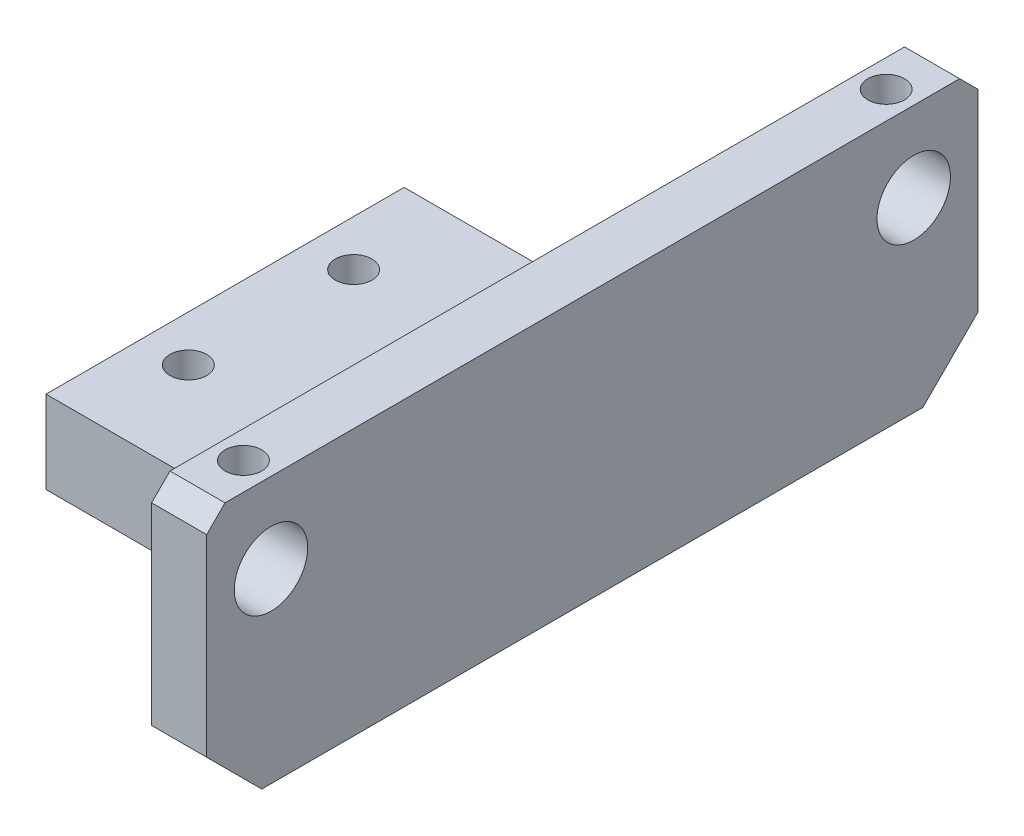
from build123d import *

# Parameters (mm, degrees)
SKETCH1_W           = 34
SKETCH1_H           = 39
SKETCH1_R           = 2
BOSS_EXTRUDE1_DEPTH = 5
SKETCH2_W           = 6
SKETCH2_H           = 84
BOSS_EXTRUDE2_DEPTH = 25
CUT_EXTRUDE2_REACH  = 65.159
SKETCH3_R           = 4
CHAMFER1_SIZE       = 2
SKETCH4_R           = 2
CUT_EXTRUDE3_DEPTH  = 10
BOSS_EXTRUDE3_DEPTH = 4
SKETCH6_R           = 3.7
CUT_EXTRUDE4_DEPTH  = 5
CHAMFER2_SIZE       = 4
CUT_EXTRUDE5_REACH  = 57.982
SKETCH7_R           = 1.35


with BuildPart() as part:
    # Sketch1 → Boss-Extrude1 (new body)
    with BuildSketch(Plane(origin=(0, 0, 0), x_dir=(1, 0, 0), z_dir=(0, 1, 0))):
        Rectangle(SKETCH1_W, SKETCH1_H)
        with Locations(Location((-12, -9, 0), (0, 0, 270))):
            Circle(SKETCH1_R, mode=Mode.SUBTRACT)
        with Locations(Location((12, -9, 0), (0, 0, 90))):
            Circle(SKETCH1_R, mode=Mode.SUBTRACT)
        with Locations(Location((12, 9, 0), (0, 0, 270))):
            Circle(SKETCH1_R, mode=Mode.SUBTRACT)
        with Locations(Location((-12, 9, 0), (0, 0, 90))):
            Circle(SKETCH1_R, mode=Mode.SUBTRACT)
    extrude(amount=BOSS_EXTRUDE1_DEPTH)

    # Sketch2 → Boss-Extrude2 (add)
    with BuildSketch(Plane.XZ):
        with Locations((20, 0)):
            Rectangle(SKETCH2_W, SKETCH2_H)
    extrude(amount=-BOSS_EXTRUDE2_DEPTH)

    # Sketch3 → Cut-Extrude2 (cut, up to next)
    with BuildSketch(Plane(origin=(23, 0, 0), x_dir=(0, 0, -1), z_dir=(1, 0, 0)), mode=Mode.PRIVATE) as cut_extrude2_sk1:
        with Locations((-35, 16.275206728)):
            Circle(SKETCH3_R)
    cut_extrude2_tool1 = extrude(cut_extrude2_sk1.sketch, amount=-CUT_EXTRUDE2_REACH, mode=Mode.PRIVATE) & part.part
    # Sketch3 → Cut-Extrude2 (cut, up to next)
    with BuildSketch(Plane(origin=(23, 0, 0), x_dir=(0, 0, -1), z_dir=(1, 0, 0)), mode=Mode.PRIVATE) as cut_extrude2_sk2:
        with Locations((35, 16.275206728)):
            Circle(SKETCH3_R)
    cut_extrude2_tool2 = extrude(cut_extrude2_sk2.sketch, amount=-CUT_EXTRUDE2_REACH, mode=Mode.PRIVATE) & part.part
    add(cut_extrude2_tool1.solids().sort_by_distance((23, 16.275207, 35))[0], mode=Mode.SUBTRACT)
    add(cut_extrude2_tool2.solids().sort_by_distance((23, 16.275207, -35))[0], mode=Mode.SUBTRACT)

    # Chamfer1
    chamfer1_edges = [part.edges().sort_by_distance(p)[0] for p in [
        (20, 25, -42),
        (20, 25, 42),
        (20, 0, 42),
        (20, 0, -42),
    ]]
    chamfer(chamfer1_edges, length=CHAMFER1_SIZE)

    # Sketch4 → Cut-Extrude3 (cut)
    with BuildSketch(Plane(origin=(0, 25, 0), x_dir=(1, 0, 0), z_dir=(0, 1, 0))):
        with Locations(Location((20, 35, 0), (0, 0, 270))):
            Circle(SKETCH4_R)
        with Locations(Location((20, -35, 0), (0, 0, 270))):
            Circle(SKETCH4_R)
    extrude(amount=-CUT_EXTRUDE3_DEPTH, mode=Mode.SUBTRACT)

    # Sketch5 → Boss-Extrude3 (add)
    with BuildSketch(Plane.XZ):
        Polygon((17, -19.5), (17, -40), (23, -40), (23, 40), (17, 40), (17, 19.5), (-17, 19.5), (-17, -19.5), align=None)
    extrude(amount=BOSS_EXTRUDE3_DEPTH)

    # Sketch6 → Cut-Extrude4 (cut)
    with BuildSketch(Plane.XZ.offset(4)):
        with Locations(Location((-12, -9, 0), (0, 0, 270))):
            Circle(SKETCH6_R)
        with Locations(Location((12, -9, 0), (0, 0, 90))):
            Circle(SKETCH6_R)
        with Locations(Location((12, 9, 0), (0, 0, 270))):
            Circle(SKETCH6_R)
        with Locations(Location((-12, 9, 0), (0, 0, 90))):
            Circle(SKETCH6_R)
    extrude(amount=-CUT_EXTRUDE4_DEPTH, mode=Mode.SUBTRACT)

    # Chamfer2
    chamfer2_edges = [part.edges().sort_by_distance(p)[0] for p in [
        (20, -4, 40),
        (20, -4, -40),
    ]]
    chamfer(chamfer2_edges, length=CHAMFER2_SIZE - 0.0001)  # a hair under: the kernel refuses the full size

    # Sketch7 → Cut-Extrude5 (cut, up to next)
    with BuildSketch(Plane.XZ.offset(4), mode=Mode.PRIVATE) as cut_extrude5_sk1:
        with Locations(Location((12, 15, 0), (0, 0, 270))):
            Circle(SKETCH7_R)
    cut_extrude5_tool1 = extrude(cut_extrude5_sk1.sketch, amount=-CUT_EXTRUDE5_REACH, mode=Mode.PRIVATE) & part.part
    # Sketch7 → Cut-Extrude5 (cut, up to next)
    with BuildSketch(Plane.XZ.offset(4), mode=Mode.PRIVATE) as cut_extrude5_sk2:
        with Locations(Location((12, -15, 0), (0, 0, 270))):
            Circle(SKETCH7_R)
    cut_extrude5_tool2 = extrude(cut_extrude5_sk2.sketch, amount=-CUT_EXTRUDE5_REACH, mode=Mode.PRIVATE) & part.part
    add(cut_extrude5_tool1.solids().sort_by_distance((12, -4, 15))[0], mode=Mode.SUBTRACT)
    add(cut_extrude5_tool2.solids().sort_by_distance((12, -4, -15))[0], mode=Mode.SUBTRACT)


solid = part.part
